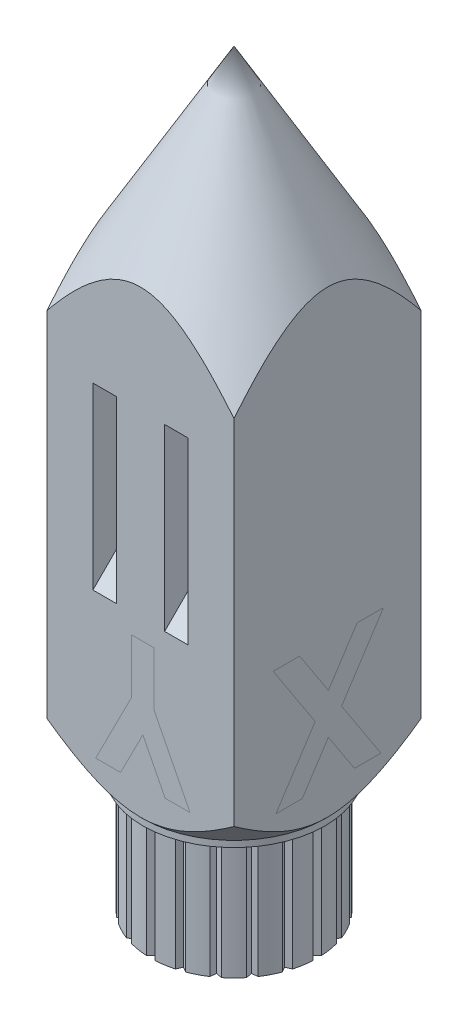
from build123d import *

# Parameters (mm, degrees)
SKETCH2_R           = 5.35
SKETCH2_R_2         = 3.35
BOSS_EXTRUDE1_DEPTH = 8
BOSS_EXTRUDE2_START = -0.4
SKETCH3_R           = 5.85
SKETCH3_R_2         = 5.35
BOSS_EXTRUDE2_DEPTH = 0.4
BOSS_EXTRUDE3_DEPTH = 8
CUT_EXTRUDE1_DEPTH  = 7.6
CIRPATTERN2_COUNT   = 20
SKETCH7_W           = 12
SKETCH7_H           = 12
BOSS_EXTRUDE4_DEPTH = 40
CUT_EXTRUDE2_DEPTH  = 1
BOSS_EXTRUDE5_DEPTH = 1
CUT_EXTRUDE3_DEPTH  = 1
BOSS_EXTRUDE6_DEPTH = 1
SKETCH15_W          = 6.1
SKETCH15_H          = 6.1
CUT_EXTRUDE4_DEPTH  = 3.5
SKETCH16_W          = 1.5
SKETCH16_H          = 1.5
CUT_EXTRUDE5_DEPTH  = 8.5
SKETCH18_W          = 1.5
SKETCH18_H          = 10
CUT_EXTRUDE7_DEPTH  = 2
CHAMFER1_SIZE       = 2


# Read off the part's stored shape, not the designer's step: Cut-Revolve4
with BuildPart() as part:
    # Sketch2 → Boss-Extrude1 (new body)
    with BuildSketch(Plane(origin=(0, 0, 0), x_dir=(1, 0, 0), z_dir=(0, 1, 0))):
        with Locations(Location((0, 0, 0), (0, 0, 270))):
            Circle(SKETCH2_R)
        with Locations(Location((0, 0, 0), (0, 0, 270))):
            Circle(SKETCH2_R_2, mode=Mode.SUBTRACT)
    extrude(amount=BOSS_EXTRUDE1_DEPTH)

    # Sketch3 → Boss-Extrude2 (add)
    with BuildSketch(Plane(origin=(0, 8, 0), x_dir=(1, 0, 0), z_dir=(0, 1, 0)).offset(BOSS_EXTRUDE2_START)):
        with Locations(Location((0, 0, 0), (0, 0, 270))):
            Circle(SKETCH3_R)
        with Locations(Location((0, 0, 0), (0, 0, 270))):
            Circle(SKETCH3_R_2, mode=Mode.SUBTRACT)
    extrude(amount=BOSS_EXTRUDE2_DEPTH)

    # Sketch4 → Boss-Extrude3 (add)
    with BuildSketch(Plane.XZ):
        with BuildLine():
            Line((-0.524055458, -3.308755941), (0, -2.73))
            Line((0, -2.73), (0.524055458, -3.308755941))
            ThreePointArc((0.524055458, -3.308755941), (0, -3.35), (-0.524055458, -3.308755941))
        make_face()
    boss_extrude3 = extrude(amount=-BOSS_EXTRUDE3_DEPTH)

    # Sketch5 → Cut-Extrude1 (cut)
    with BuildSketch(Plane.XZ):
        with BuildLine():
            Line((-0.265669304, -5.34339965), (0, -5.05))
            Line((0, -5.05), (0.265669304, -5.34339965))
            ThreePointArc((0.265669304, -5.34339965), (0, -5.35), (-0.265669304, -5.34339965))
        make_face()
    cut_extrude1 = extrude(amount=-CUT_EXTRUDE1_DEPTH, mode=Mode.SUBTRACT)

    # CirPattern2: Boss-Extrude3, Cut-Extrude1 ×20 about axis
    cirpattern2_axis = Axis((0, 0, 0), (0, 1, 0))
    add([boss_extrude3.rotate(cirpattern2_axis, i * 360 / CIRPATTERN2_COUNT) for i in range(1, CIRPATTERN2_COUNT)])
    add([cut_extrude1.rotate(cirpattern2_axis, i * 360 / CIRPATTERN2_COUNT) for i in range(1, CIRPATTERN2_COUNT)], mode=Mode.SUBTRACT)

    # Sketch6 → Cut-Revolve1 (revolve, cut)
    with BuildSketch(Plane.XY):
        Polygon((-3.35, 0), (-2.35, 1), (-2.35, 0), align=None)
    revolve(axis=Axis((0, 0, 0), (0, 1, 0)), mode=Mode.SUBTRACT)

    # Sketch7 → Boss-Extrude4 (add)
    with BuildSketch(Plane(origin=(0, 8, 0), x_dir=(1, 0, 0), z_dir=(0, 1, 0))):
        Rectangle(SKETCH7_W, SKETCH7_H)
    extrude(amount=BOSS_EXTRUDE4_DEPTH)

    # Cut-Revolve4 outline → Cut-Revolve4 (revolve, cut)
    with BuildSketch(Plane.XY):
        Polygon((8.485281506, 10.635281506), (5.85, 8), (8.485281374, 8), align=None)
        Polygon((0, 48), (8.485281381, 33.303061532), (8.485281506, 48), align=None)
    revolve(axis=Axis((0, 0, 0), (0, 1, 0)), mode=Mode.SUBTRACT)

    # Sketch10 → Cut-Extrude2 (cut)
    with BuildSketch(Plane(origin=(6, 0, 0), x_dir=(0, 0, -1), z_dir=(1, 0, 0))):
        Polygon((-3.309294872, 10), (-1.616987179, 10), (0.054487179, 12.568910256), (1.729166667, 10), (3.426282051, 10), (0.90224359, 13.870192308), (3.58974359, 18), (1.897435897, 18), (0.054487179, 15.168269231), (-1.791666667, 18), (-3.487179487, 18), (-0.791666667, 13.866987179), align=None)
    extrude(amount=-CUT_EXTRUDE2_DEPTH, mode=Mode.SUBTRACT)

    # Sketch13 → Cut-Extrude3 (cut)
    with BuildSketch(Plane.XY.offset(6)):
        Polygon((3.179487179, 10), (1.581730769, 10), (0.153846154, 12.807692308), (-1.27724359, 10), (-2.871794872, 10), (-0.564102564, 14.53525641), (-0.564102564, 18), (0.871794872, 18), (0.871794872, 14.53525641), align=None)
    extrude(amount=-CUT_EXTRUDE3_DEPTH, mode=Mode.SUBTRACT)

    # Sketch15 → Cut-Extrude4 (cut)
    with BuildSketch(Plane(origin=(0, 0, -6), x_dir=(-1, 0, 0), z_dir=(0, 0, -1))):
        with Locations((0, 30)):
            Rectangle(SKETCH15_W, SKETCH15_H)
    extrude(amount=-CUT_EXTRUDE4_DEPTH, mode=Mode.SUBTRACT)

    # Sketch16 → Cut-Extrude5 (cut)
    with BuildSketch(Plane(origin=(0, 0, -2.5), x_dir=(-1, 0, 0), z_dir=(0, 0, -1))):
        with Locations((-2.3, 30)):
            Rectangle(SKETCH16_W, SKETCH16_H)
        with Locations((2.3, 30)):
            Rectangle(SKETCH16_W, SKETCH16_H)
    extrude(amount=-CUT_EXTRUDE5_DEPTH, mode=Mode.SUBTRACT)

    # Sketch18 → Cut-Extrude7 (cut)
    with BuildSketch(Plane.XY.offset(6)):
        with Locations((-2.3, 24.25)):
            Rectangle(SKETCH18_W, SKETCH18_H)
        with Locations((2.3, 24.25)):
            Rectangle(SKETCH18_W, SKETCH18_H)
    extrude(amount=-CUT_EXTRUDE7_DEPTH, mode=Mode.SUBTRACT)

    # Chamfer1
    chamfer1_edges = [part.edges().sort_by_distance(p)[0] for p in [
        (-2.3, 19.25, 4),
        (2.3, 19.25, 4),
    ]]
    chamfer(chamfer1_edges, length=CHAMFER1_SIZE - 0.0001)  # a hair under: the kernel refuses the full size


with BuildPart() as body_2:
    # Sketch11 → Boss-Extrude5 (new body)
    with BuildSketch(Plane(origin=(5, 0, 0), x_dir=(0, 0, -1), z_dir=(1, 0, 0))):
        Polygon((-0.791666667, 13.866987179), (-3.309294872, 10), (-1.616987179, 10), (0.054487179, 12.568910256), (1.729166667, 10), (3.426282051, 10), (0.90224359, 13.870192308), (3.58974359, 18), (1.897435897, 18), (0.054487179, 15.168269231), (-1.791666667, 18), (-3.487179487, 18), align=None)
    extrude(amount=BOSS_EXTRUDE5_DEPTH)


with BuildPart() as body_3:
    # Sketch14 → Boss-Extrude6 (new body)
    with BuildSketch(Plane.XY.offset(5)):
        Polygon((3.179487179, 10), (0.871794872, 14.53525641), (0.871794872, 18), (-0.564102564, 18), (-0.564102564, 14.53525641), (-2.871794872, 10), (-1.27724359, 10), (0.153846154, 12.807692308), (1.581730769, 10), align=None)
    extrude(amount=BOSS_EXTRUDE6_DEPTH)


solid = Compound([part.part, body_2.part, body_3.part])
